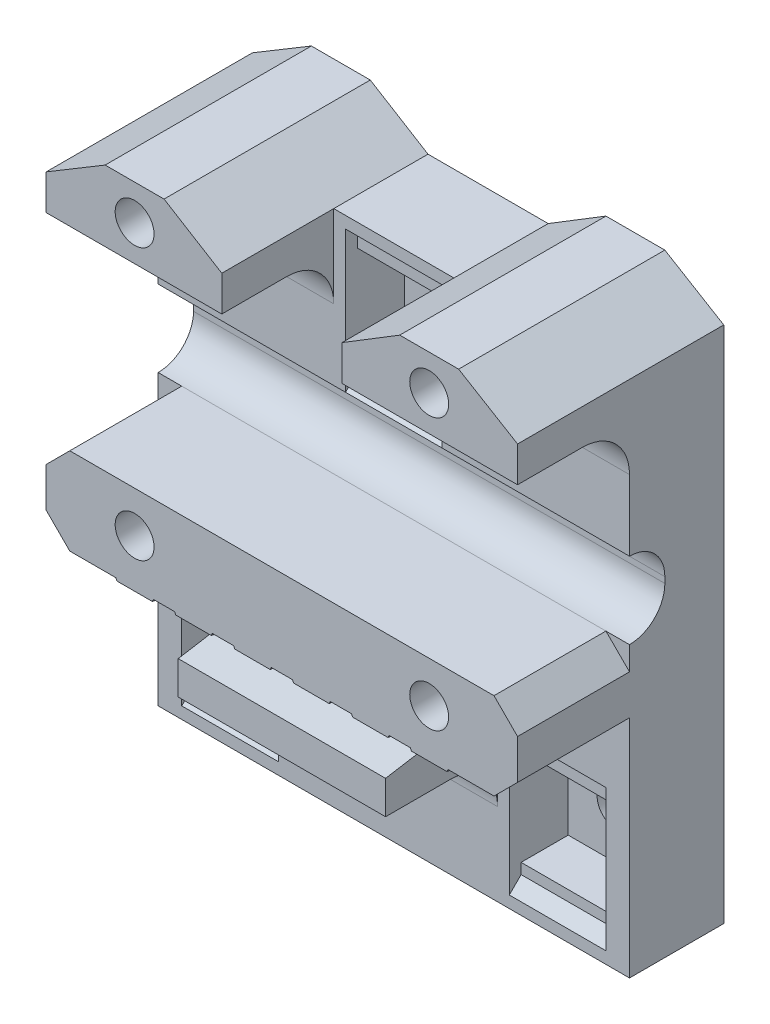
from build123d import *
from OCP.BRepFilletAPI import BRepFilletAPI_MakeChamfer

# Parameters (mm, degrees)
SKETCH1_W                       = 40
SKETCH1_H                       = 44
BOSS_EXTRUDE1_DEPTH             = 8
SKETCH2_W                       = 8.2
SKETCH2_H                       = 10
CUT_EXTRUDE1_DEPTH              = 1
SKETCH3_W                       = 8.2
SKETCH3_H                       = 8.2
CUT_EXTRUDE2_DEPTH              = 4
CHAMFER1_SIZE                   = 1
SKETCH4_R                       = 1.65
CUT_EXTRUDE3_DEPTH              = 56.398555938
SKETCH5_W                       = 17.6
SKETCH5_H                       = 3.325
BOSS_EXTRUDE2_DEPTH             = 9.5
BOSS_EXTRUDE2_DIRECTION_2_REACH = 57.749
FILLET1_R                       = 4
SKETCH6_R                       = 1.65
CUT_EXTRUDE4_DEPTH              = 60.893655758
CHAMFER2_SIZE                   = 2
SKETCH7_W                       = 40
SKETCH7_H                       = 6.5
CUT_EXTRUDE5_DEPTH              = 3
FILLET2_R                       = 3
CHAMFER3_SIZE                   = 3
CHAMFER3_SIZE2                  = 1
CHAMFER4_SIZE                   = 3
CHAMFER4_SIZE2                  = 0.5


with BuildPart() as part:
    # Sketch1 → Boss-Extrude1 (new body)
    with BuildSketch(Plane.XY):
        with Locations((20, 16)):
            Rectangle(SKETCH1_W, SKETCH1_H)
    extrude(amount=BOSS_EXTRUDE1_DEPTH)

    # Sketch2 → Cut-Extrude1 (cut)
    with BuildSketch(Plane.XY.offset(8)):
        with Locations((20, 31)):
            Rectangle(SKETCH2_W, SKETCH2_H)
        with Locations((6.1, 1)):
            Rectangle(SKETCH2_W, SKETCH2_H)
        with Locations((33.9, 1)):
            Rectangle(SKETCH2_W, SKETCH2_H)
    extrude(amount=-CUT_EXTRUDE1_DEPTH, mode=Mode.SUBTRACT)

    # Sketch3 → Cut-Extrude2 (cut)
    with BuildSketch(Plane.XY.offset(7)):
        with Locations((20, 31)):
            Rectangle(SKETCH3_W, SKETCH3_H)
        with Locations((6.1, 1)):
            Rectangle(SKETCH3_W, SKETCH3_H)
        with Locations((33.9, 1)):
            Rectangle(SKETCH3_W, SKETCH3_H)
    extrude(amount=-CUT_EXTRUDE2_DEPTH, mode=Mode.SUBTRACT)

    # Chamfer1
    chamfer1_edges = [part.edges().sort_by_distance(p)[0] for p in [
        (20, 26, 8),
        (20, 36, 8),
        (33.9, -4, 8),
        (33.9, 6, 8),
        (6.1, -4, 8),
        (6.1, 6, 8),
    ]]
    chamfer(chamfer1_edges, length=CHAMFER1_SIZE - 0.0001)  # a hair under: the kernel refuses the full size

    # Sketch4 → Cut-Extrude3 (cut, through all)
    with BuildSketch(Plane.XY.offset(3)):
        with Locations((20, 31)):
            Circle(SKETCH4_R)
        with Locations((6.1, 1)):
            Circle(SKETCH4_R)
        with Locations((33.9, 1)):
            Circle(SKETCH4_R)
    extrude(amount=-CUT_EXTRUDE3_DEPTH, mode=Mode.SUBTRACT)

    # Sketch5 → Boss-Extrude2 (add)
    with BuildSketch(Plane.XY.offset(8)):
        Polygon((20.9, 11.125), (19.1, 11.125), (18.5, 9.925), (16.5, 9.925), (15.9, 11.125), (14.1, 11.125), (13.5, 9.925), (11.5, 9.925), (10.9, 11.125), (9.1, 11.125), (8.5, 9.925), (6.5, 9.925), (5.9, 11.125), (4.1, 11.125), (0, 11.125), (0, 18.5), (40, 18.5), (40, 11.125), (35.9, 11.125), (34.1, 11.125), (33.5, 9.925), (31.5, 9.925), (30.9, 11.125), (29.1, 11.125), (28.5, 9.925), (26.5, 9.925), (25.9, 11.125), (24.1, 11.125), (23.5, 9.925), (21.5, 9.925), align=None)
        with Locations((20, 6.6625)):
            Rectangle(SKETCH5_W, SKETCH5_H)
        Polygon((0, 35), (14.9, 35), (14.9, 38), (10, 41), (5, 41), (0, 38), align=None)
        Polygon((25.1, 38), (30, 41), (35, 41), (40, 38), (40, 35), (25.1, 35), align=None)
    extrude(amount=BOSS_EXTRUDE2_DEPTH)

    # Boss-Extrude2 direction 2: up to this face of the body (flat: up to its plane)
    boss_extrude2_direction_2_end = Plane(part.part.faces().sort_by_distance((20, 16.073973219, 0))[0])
    # Sketch5 → Boss-Extrude2 direction 2 (add, up to the picked face)
    with BuildSketch(Plane.XY.offset(8), mode=Mode.PRIVATE) as boss_extrude2_direction_2_sk1:
        Polygon((20.9, 11.125), (19.1, 11.125), (18.5, 9.925), (16.5, 9.925), (15.9, 11.125), (14.1, 11.125), (13.5, 9.925), (11.5, 9.925), (10.9, 11.125), (9.1, 11.125), (8.5, 9.925), (6.5, 9.925), (5.9, 11.125), (4.1, 11.125), (0, 11.125), (0, 18.5), (40, 18.5), (40, 11.125), (35.9, 11.125), (34.1, 11.125), (33.5, 9.925), (31.5, 9.925), (30.9, 11.125), (29.1, 11.125), (28.5, 9.925), (26.5, 9.925), (25.9, 11.125), (24.1, 11.125), (23.5, 9.925), (21.5, 9.925), align=None)
    boss_extrude2_direction_2_tool1 = split(extrude(boss_extrude2_direction_2_sk1.sketch, amount=-BOSS_EXTRUDE2_DIRECTION_2_REACH, mode=Mode.PRIVATE), bisect_by=boss_extrude2_direction_2_end, keep=Keep.BOTH, mode=Mode.PRIVATE)
    # Sketch5 → Boss-Extrude2 direction 2 (add, up to the picked face)
    with BuildSketch(Plane.XY.offset(8), mode=Mode.PRIVATE) as boss_extrude2_direction_2_sk2:
        with Locations((20, 6.6625)):
            Rectangle(SKETCH5_W, SKETCH5_H)
    boss_extrude2_direction_2_tool2 = split(extrude(boss_extrude2_direction_2_sk2.sketch, amount=-BOSS_EXTRUDE2_DIRECTION_2_REACH, mode=Mode.PRIVATE), bisect_by=boss_extrude2_direction_2_end, keep=Keep.BOTH, mode=Mode.PRIVATE)
    # Sketch5 → Boss-Extrude2 direction 2 (add, up to the picked face)
    with BuildSketch(Plane.XY.offset(8), mode=Mode.PRIVATE) as boss_extrude2_direction_2_sk3:
        Polygon((0, 35), (14.9, 35), (14.9, 38), (10, 41), (5, 41), (0, 38), align=None)
    boss_extrude2_direction_2_tool3 = split(extrude(boss_extrude2_direction_2_sk3.sketch, amount=-BOSS_EXTRUDE2_DIRECTION_2_REACH, mode=Mode.PRIVATE), bisect_by=boss_extrude2_direction_2_end, keep=Keep.BOTH, mode=Mode.PRIVATE)
    # Sketch5 → Boss-Extrude2 direction 2 (add, up to the picked face)
    with BuildSketch(Plane.XY.offset(8), mode=Mode.PRIVATE) as boss_extrude2_direction_2_sk4:
        Polygon((25.1, 38), (30, 41), (35, 41), (40, 38), (40, 35), (25.1, 35), align=None)
    boss_extrude2_direction_2_tool4 = split(extrude(boss_extrude2_direction_2_sk4.sketch, amount=-BOSS_EXTRUDE2_DIRECTION_2_REACH, mode=Mode.PRIVATE), bisect_by=boss_extrude2_direction_2_end, keep=Keep.BOTH, mode=Mode.PRIVATE)
    add(boss_extrude2_direction_2_tool1.solids().sort_by(Axis((20, 14.559414, 8), (0, 0, -1)))[0])
    add(boss_extrude2_direction_2_tool2.solids().sort_by(Axis((20, 6.6625, 8), (0, 0, -1)))[0])
    add(boss_extrude2_direction_2_tool3.solids().sort_by(Axis((7.45835, 37.60161, 8), (0, 0, -1)))[0])
    add(boss_extrude2_direction_2_tool4.solids().sort_by(Axis((32.54165, 37.60161, 8), (0, 0, -1)))[0])

    # Fillet1
    fillet1_edges = [part.edges().sort_by_distance(p)[0] for p in [
        (20, 5, 8),
        (7.45, 35, 8),
        (32.55, 35, 8),
    ]]
    fillet(fillet1_edges, radius=FILLET1_R)

    # Sketch6 → Cut-Extrude4 (cut, through all)
    with BuildSketch(Plane.XY.offset(17.5)):
        with Locations((7.5, 38)):
            Circle(SKETCH6_R)
        with Locations((7.5, 15)):
            Circle(SKETCH6_R)
        with Locations(Location((32.5, 38, 0), (0, 0, 180))):
            Circle(SKETCH6_R)
        with Locations(Location((32.5, 15, 0), (0, 0, 180))):
            Circle(SKETCH6_R)
    extrude(amount=-CUT_EXTRUDE4_DEPTH, mode=Mode.SUBTRACT)

    # Chamfer2
    chamfer2_edges = [part.edges().sort_by_distance(p)[0] for p in [
        (0, 11.125, 12.75),
        (0, 18.5, 12.75),
        (40, 18.5, 12.75),
        (40, 11.125, 12.75),
    ]]
    chamfer(chamfer2_edges, length=CHAMFER2_SIZE)

    # Sketch7 → Cut-Extrude5 (cut)
    with BuildSketch(Plane.XY.offset(8)):
        with Locations((20, 21.75)):
            Rectangle(SKETCH7_W, SKETCH7_H)
    extrude(amount=-CUT_EXTRUDE5_DEPTH, mode=Mode.SUBTRACT)

    # Fillet2
    fillet2_edges = [part.edges().sort_by_distance(p)[0] for p in [
        (20, 18.5, 5),
        (20, 25, 5),
    ]]
    fillet(fillet2_edges, radius=FILLET2_R - 0.0001)  # a hair under: the kernel refuses the full size

    # Chamfer3: one chamfer whose edges measure the first distance from different faces: ONE call of the kernel's chamfer builder (chamfer() names one face for all edges)
    chamfer3_edges_1 = [part.edges().sort_by_distance(p)[0] for p in [
        (22.5, 9.925, 17.5),
    ]]
    chamfer3_side_1 = [part.faces().sort_by_distance(p)[0] for p in [
        (22.5, 9.925, 12.75),
    ]]
    chamfer3_edges_2 = [part.edges().sort_by_distance(p)[0] for p in [
        (27.5, 9.925, 17.5),
    ]]
    chamfer3_side_2 = [part.faces().sort_by_distance(p)[0] for p in [
        (27.5, 9.925, 12.75),
    ]]
    chamfer3_edges_3 = [part.edges().sort_by_distance(p)[0] for p in [
        (32.5, 9.925, 17.5),
    ]]
    chamfer3_side_3 = [part.faces().sort_by_distance(p)[0] for p in [
        (32.5, 9.925, 12.75),
    ]]
    chamfer3_edges_4 = [part.edges().sort_by_distance(p)[0] for p in [
        (7.5, 9.925, 17.5),
    ]]
    chamfer3_side_4 = [part.faces().sort_by_distance(p)[0] for p in [
        (7.5, 9.925, 12.75),
    ]]
    chamfer3_edges_5 = [part.edges().sort_by_distance(p)[0] for p in [
        (12.5, 9.925, 17.5),
    ]]
    chamfer3_side_5 = [part.faces().sort_by_distance(p)[0] for p in [
        (12.5, 9.925, 12.75),
    ]]
    chamfer3_edges_6 = [part.edges().sort_by_distance(p)[0] for p in [
        (17.5, 9.925, 17.5),
    ]]
    chamfer3_side_6 = [part.faces().sort_by_distance(p)[0] for p in [
        (17.5, 9.925, 12.75),
    ]]
    chamfer3 = BRepFilletAPI_MakeChamfer(part.part.solid().wrapped)
    for e in chamfer3_edges_1:
        chamfer3.Add(CHAMFER3_SIZE, CHAMFER3_SIZE2, e.wrapped, chamfer3_side_1[0].wrapped)  # the first distance lies on this face
    for e in chamfer3_edges_2:
        chamfer3.Add(CHAMFER3_SIZE, CHAMFER3_SIZE2, e.wrapped, chamfer3_side_2[0].wrapped)  # the first distance lies on this face
    for e in chamfer3_edges_3:
        chamfer3.Add(CHAMFER3_SIZE, CHAMFER3_SIZE2, e.wrapped, chamfer3_side_3[0].wrapped)  # the first distance lies on this face
    for e in chamfer3_edges_4:
        chamfer3.Add(CHAMFER3_SIZE, CHAMFER3_SIZE2, e.wrapped, chamfer3_side_4[0].wrapped)  # the first distance lies on this face
    for e in chamfer3_edges_5:
        chamfer3.Add(CHAMFER3_SIZE, CHAMFER3_SIZE2, e.wrapped, chamfer3_side_5[0].wrapped)  # the first distance lies on this face
    for e in chamfer3_edges_6:
        chamfer3.Add(CHAMFER3_SIZE, CHAMFER3_SIZE2, e.wrapped, chamfer3_side_6[0].wrapped)  # the first distance lies on this face
    add(Compound.cast(chamfer3.Shape()), mode=Mode.REPLACE)

    # Chamfer4
    chamfer4_edges = [part.edges().sort_by_distance(p)[0] for p in [
        (20, 8.325, 17.5),
    ]]
    chamfer4_side = [part.faces().sort_by_distance(p)[0] for p in [
        (20, 8.325, 12.75),
    ]]
    chamfer(chamfer4_edges, length=CHAMFER4_SIZE, length2=CHAMFER4_SIZE2, reference=chamfer4_side[0])


solid = part.part
